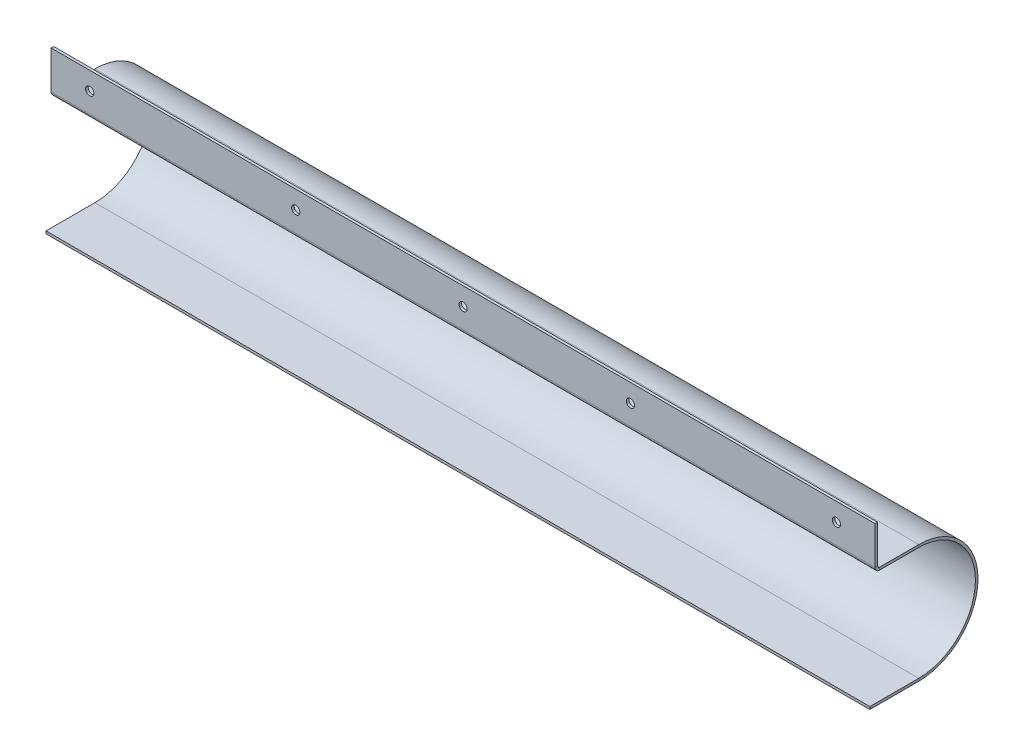
from build123d import *

# Parameters (mm, degrees)
SM_BASE_FLANGE_1_DEPTH = 160
OTHER_START            = -160
OTHER_1_DEPTH          = 320
OTHER_1_2_DEPTH        = 320
SKETCH_4_R             = 1.6
CUT_EXTRUDE_1_DEPTH    = 2


# Read off the part's stored shape, not the designer's step: 绘制的折弯1
# Sheet-metal steps are written as plain solids
with BuildPart() as part:
    # Sketch 1 → 基体-法兰1 (new, symmetric)
    with BuildSketch(Plane(origin=(0, 0, 0), x_dir=(0, 0, -1), z_dir=(1, 0, 0))):
        with BuildLine():
            Line((-32, 23), (0, 23))
            ThreePointArc((0, 23), (23, 0), (0, -23))
            Line((0, -23), (-19, -23))
            Line((-19, -23), (-19, -22))
            Line((-19, -22), (0, -22))
            ThreePointArc((0, -22), (22, 0), (0, 22))
            Line((0, 22), (-32, 22))
            Line((-32, 22), (-32, 23))
        make_face()
    extrude(amount=SM_BASE_FLANGE_1_DEPTH, both=True)

    # Other 1 outline → Other 1 (cut)
    with BuildSketch(Plane.YZ.offset(OTHER_START)):
        with BuildLine():
            ThreePointArc((22, 15.2634), (22.271171885, 16.195226164), (23, 16.83604109))
            Line((23, 16.83604109), (23, 32))
            Line((23, 32), (22, 32))
            Line((22, 32), (22, 15.2634))
        make_face()
    extrude(amount=OTHER_1_DEPTH, mode=Mode.SUBTRACT)

    # Other 1 2 outline → Other 1 2 (add)
    with BuildSketch(Plane.YZ.offset(OTHER_START)):
        with BuildLine():
            ThreePointArc((23, 15.2634), (23.215745145, 15.784254855), (23.7366, 16))
            Line((23.7366, 16), (38.530753262, 16))
            Line((38.530753262, 16), (38.530753262, 17))
            Line((38.530753262, 17), (23.7366, 17))
            ThreePointArc((23.7366, 17), (23.359286442, 16.958514757), (23, 16.83604109))
            Line((23, 16.83604109), (23, 15.2634))
        make_face()
    extrude(amount=OTHER_1_2_DEPTH)

    # 草图4 → 切除-拉伸1 (cut)
    with BuildSketch(Plane(origin=(0, 0, 16), x_dir=(-1, 0, 0), z_dir=(0, 0, -1))):
        with Locations(Location((0, 31.530753262, 0), (0, 0, 90))):
            Circle(SKETCH_4_R)
        with Locations(Location((145, 31.530753262, 0), (0, 0, 90))):
            Circle(SKETCH_4_R)
        with Locations(Location((65, 31.530753262, 0), (0, 0, 90))):
            Circle(SKETCH_4_R)
        with Locations(Location((-145, 31.530753262, 0), (0, 0, 90))):
            Circle(SKETCH_4_R)
        with Locations(Location((-65, 31.530753262, 0), (0, 0, 90))):
            Circle(SKETCH_4_R)
    extrude(amount=-CUT_EXTRUDE_1_DEPTH, mode=Mode.SUBTRACT)


solid = part.part
